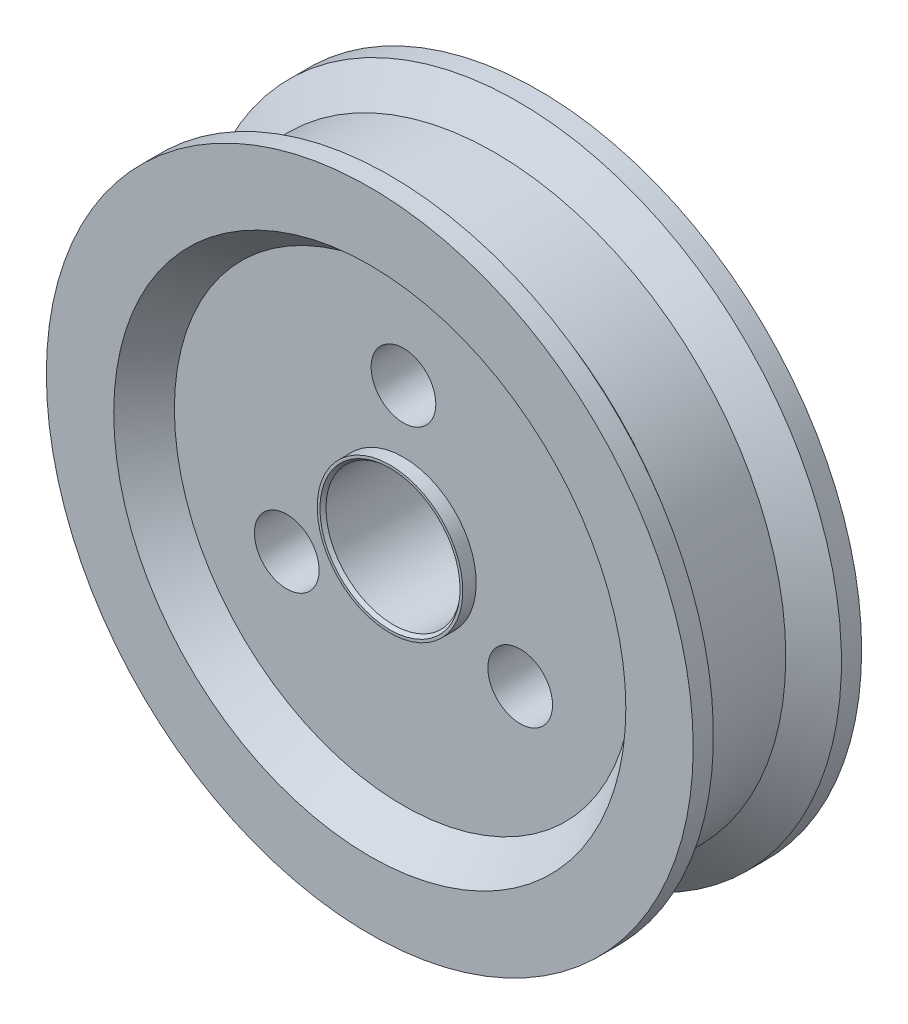
from build123d import *

# Parameters (mm, degrees)
ESQUISSE1_R             = 60
ESQUISSE1_R_2           = 12.5
BOSS_EXTRU_1_DEPTH      = 12.5
ESQUISSE3_R             = 42.5
ENL_V_MAT_EXTRU_1_DEPTH = 5
ESQUISSE4_R             = 6
ENL_V_MAT_EXTRU_2_DEPTH = 88.177978871
BOSS_EXTRU_2_DEPTH      = 2
BOSS_EXTRU_2_DEPTH_BACK = 17
ESQUISSE6_R             = 13.5
ESQUISSE6_R_2           = 12.5
CHANFREIN1_SIZE         = 5
CHANFREIN2_SIZE         = 0.5
ESCALA1_SCALE           = 0.63332
ESCALA2_SCALE_X         = 1
ESCALA2_SCALE_Y         = 1
ESCALA2_SCALE_Z         = 1.249921051


with BuildPart() as part:
    # Esquisse1 → Boss.-Extru.1 (new, symmetric)
    with BuildSketch(Plane.XY):
        Circle(ESQUISSE1_R)
        Circle(ESQUISSE1_R_2, mode=Mode.SUBTRACT)
    extrude(amount=BOSS_EXTRU_1_DEPTH, both=True)

    # Esquisse3 → Enlèv. mat.-Extru.1 (cut, symmetric)
    with BuildSketch(Plane.XY.offset(12.5)):
        Circle(ESQUISSE3_R)
    enl_v_mat_extru_1 = extrude(amount=ENL_V_MAT_EXTRU_1_DEPTH, both=True, mode=Mode.SUBTRACT)

    # Symétrie1: Enlèv. mat.-Extru.1 across plane
    add(enl_v_mat_extru_1.mirror(Plane.XY), mode=Mode.SUBTRACT)

    # Esquisse4 → Enlèv. mat.-Extru.2 (cut, through all)
    with BuildSketch(Plane.XY.offset(7.5)):
        with Locations((0, 25)):
            Circle(ESQUISSE4_R)
        with Locations((21.650635095, -12.5)):
            Circle(ESQUISSE4_R)
        with Locations((-21.650635095, -12.5)):
            Circle(ESQUISSE4_R)
    extrude(amount=-ENL_V_MAT_EXTRU_2_DEPTH, mode=Mode.SUBTRACT)

    # Esquisse5 → Enlèvement de matière-Révolution1 (revolve, cut)
    with BuildSketch(Plane(origin=(0, 0, 0), x_dir=(1, 0, 0), z_dir=(0, 1, 0)), mode=Mode.PRIVATE) as enl_vement_de_mati_re_r_volution1_sk:
        Polygon((60, 9.5), (54, 6.035898385), (54, -6.035898385), (60, -9.5), align=None)
    revolve(enl_vement_de_mati_re_r_volution1_sk.sketch.rotate(Axis((0, 0, -12.5), (0, 0, 1)), 180), axis=Axis((0, 0, -12.5), (0, 0, 1)), mode=Mode.SUBTRACT)

    # Esquisse6 → Boss.-Extru.2 (add, two sides: drawn at the far end of the back side and taken through both)
    with BuildSketch(Plane(origin=(0, 0, -7.5), x_dir=(-1, 0, 0), z_dir=(0, 0, -1)).offset(-BOSS_EXTRU_2_DEPTH_BACK)):
        Circle(ESQUISSE6_R)
        Circle(ESQUISSE6_R_2, mode=Mode.SUBTRACT)
    extrude(amount=BOSS_EXTRU_2_DEPTH + BOSS_EXTRU_2_DEPTH_BACK)

    # Chanfrein1
    chanfrein1_edges = [part.edges().sort_by_distance(p)[0] for p in [
        (-42.5, 0, 12.5),
        (-42.5, 0, -12.5),
    ]]
    chamfer(chanfrein1_edges, length=CHANFREIN1_SIZE - 0.0001)  # a hair under: the kernel refuses the full size

    # Chanfrein2
    chanfrein2_edges = [part.edges().sort_by_distance(p)[0] for p in [
        (12.5, 0, 9.5),
        (12.5, 0, -9.5),
    ]]
    chamfer(chanfrein2_edges, length=CHANFREIN2_SIZE)


with BuildPart() as part_1:
    # Escala1: scaled about (0, 0, 0)
    add(part.part.scale(ESCALA1_SCALE))


with BuildPart() as part_2:
    # Escala2: scaled about (0, 0, 0)
    add(part_1.part.scale((ESCALA2_SCALE_X, ESCALA2_SCALE_Y, ESCALA2_SCALE_Z), about=(0, 0, 0)))


solid = part_2.part
